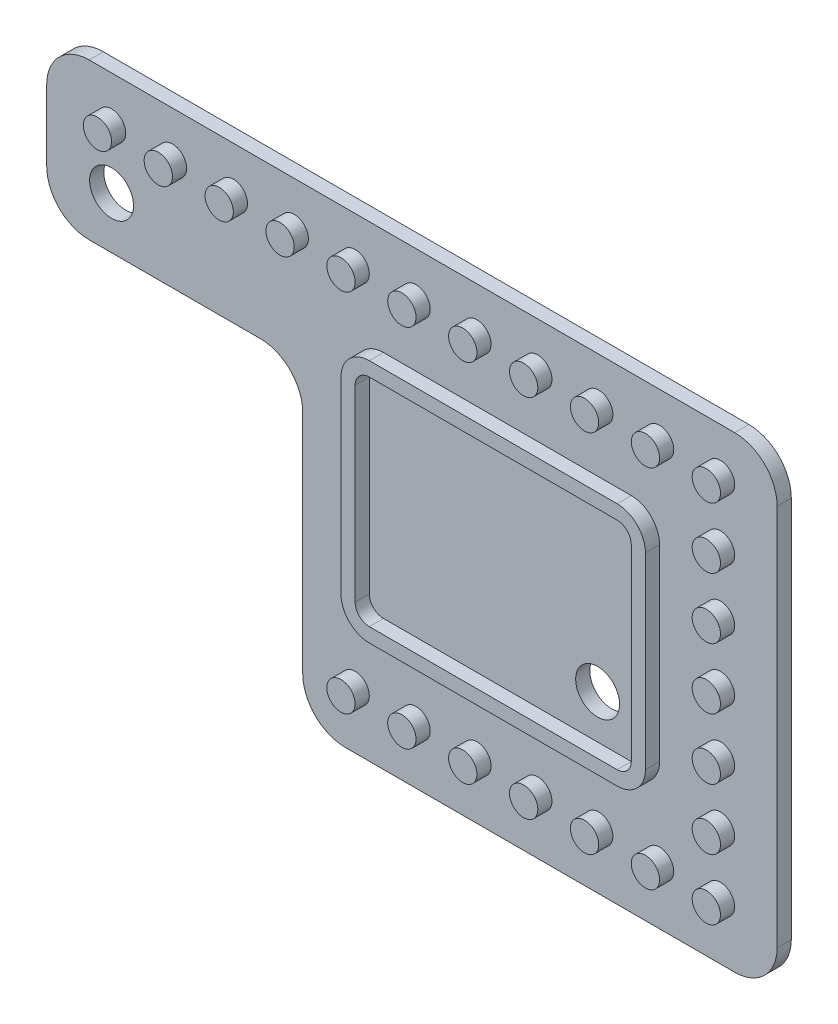
from build123d import *

# Parameters (mm, degrees)
BOSS_EXTRUDE1_DEPTH = 1
SKETCH2_R           = 1
BOSS_EXTRUDE2_DEPTH = 1
FILLET1_R           = 3
CUT_EXTRUDE1_REACH  = 72.674
SKETCH3_R           = 1.55


with BuildPart() as part:
    # Sketch1 → Boss-Extrude1 (new body)
    with BuildSketch(Plane.XY):
        Polygon((-8, 5), (-8, 38), (-59.580513121, 38), (-59.580513121, 27), (-41.5, 27), (-41.5, 5), align=None)
    extrude(amount=BOSS_EXTRUDE1_DEPTH)

    # Sketch2 → Boss-Extrude2 (add)
    # profile 1 of 24: a face of its own
    with BuildSketch(Plane.XY.offset(1)):
        with Locations((-12, 9)):
            Circle(SKETCH2_R)
    # profile 2 of 24: a face of its own
    with BuildSketch(Plane.XY.offset(1)):
        with Locations((-12, 13.3)):
            Circle(SKETCH2_R)
    # profile 3 of 24: a face of its own
    with BuildSketch(Plane.XY.offset(1)):
        with Locations((-12, 17.6)):
            Circle(SKETCH2_R)
    # profile 4 of 24: a face of its own
    with BuildSketch(Plane.XY.offset(1)):
        with Locations((-12, 21.9)):
            Circle(SKETCH2_R)
    # profile 5 of 24: a face of its own
    with BuildSketch(Plane.XY.offset(1)):
        with Locations((-12, 26.2)):
            Circle(SKETCH2_R)
    # profile 6 of 24: a face of its own
    with BuildSketch(Plane.XY.offset(1)):
        with Locations((-12, 30.5)):
            Circle(SKETCH2_R)
    # profile 7 of 24: a face of its own
    with BuildSketch(Plane.XY.offset(1)):
        with Locations((-12, 34.8)):
            Circle(SKETCH2_R)
    # profile 8 of 24: a face of its own
    with BuildSketch(Plane.XY.offset(1)):
        with Locations((-16.3, 9)):
            Circle(SKETCH2_R)
    # profile 9 of 24: a face of its own
    with BuildSketch(Plane.XY.offset(1)):
        with Locations((-20.6, 9)):
            Circle(SKETCH2_R)
    # profile 10 of 24: a face of its own
    with BuildSketch(Plane.XY.offset(1)):
        with Locations((-24.9, 9)):
            Circle(SKETCH2_R)
    # profile 11 of 24: a face of its own
    with BuildSketch(Plane.XY.offset(1)):
        with Locations((-29.2, 9)):
            Circle(SKETCH2_R)
    # profile 12 of 24: a face of its own
    with BuildSketch(Plane.XY.offset(1)):
        with Locations((-33.5, 9)):
            Circle(SKETCH2_R)
    # profile 13 of 24: a face of its own
    with BuildSketch(Plane.XY.offset(1)):
        with Locations((-37.8, 9)):
            Circle(SKETCH2_R)
    # profile 14 of 24: a face of its own
    with BuildSketch(Plane.XY.offset(1)):
        with Locations((-16.3, 34.8)):
            Circle(SKETCH2_R)
    # profile 15 of 24: a face of its own
    with BuildSketch(Plane.XY.offset(1)):
        with Locations((-20.6, 34.8)):
            Circle(SKETCH2_R)
    # profile 16 of 24: a face of its own
    with BuildSketch(Plane.XY.offset(1)):
        with Locations((-24.9, 34.8)):
            Circle(SKETCH2_R)
    # profile 17 of 24: a face of its own
    with BuildSketch(Plane.XY.offset(1)):
        with Locations((-29.2, 34.8)):
            Circle(SKETCH2_R)
    # profile 18 of 24: a face of its own
    with BuildSketch(Plane.XY.offset(1)):
        with Locations((-33.5, 34.8)):
            Circle(SKETCH2_R)
    # profile 19 of 24: a face of its own
    with BuildSketch(Plane.XY.offset(1)):
        with Locations((-37.8, 34.8)):
            Circle(SKETCH2_R)
    # profile 20 of 24: a face of its own
    with BuildSketch(Plane.XY.offset(1)):
        with Locations((-42.1, 34.8)):
            Circle(SKETCH2_R)
    # profile 21 of 24: a face of its own
    with BuildSketch(Plane.XY.offset(1)):
        with Locations((-46.4, 34.8)):
            Circle(SKETCH2_R)
    # profile 22 of 24: a face of its own
    with BuildSketch(Plane.XY.offset(1)):
        with Locations((-50.7, 34.8)):
            Circle(SKETCH2_R)
    # profile 23 of 24: a face of its own
    with BuildSketch(Plane.XY.offset(1)):
        with Locations((-55, 34.8)):
            Circle(SKETCH2_R)
    # profile 24 of 24: a face of its own
    with BuildSketch(Plane.XY.offset(1)):
        with BuildLine():
            Line((-35.8, 30.5), (-18.3, 30.5))
            ThreePointArc((-18.3, 30.5), (-16.885786438, 29.914213562), (-16.3, 28.5))
            Line((-16.3, 28.5), (-16.3, 15.236025644))
            ThreePointArc((-16.3, 15.236025644), (-16.885786438, 13.821812082), (-18.3, 13.236025644))
            Line((-18.3, 13.236025644), (-35.8, 13.236025644))
            ThreePointArc((-35.8, 13.236025644), (-37.214213562, 13.821812082), (-37.8, 15.236025644))
            Line((-37.8, 15.236025644), (-37.8, 28.5))
            ThreePointArc((-37.8, 28.5), (-37.214213562, 29.914213562), (-35.8, 30.5))
        make_face()
        with BuildLine():
            Line((-35.8, 29.5), (-18.3, 29.5))
            ThreePointArc((-18.3, 29.5), (-17.592893219, 29.207106781), (-17.3, 28.5))
            Line((-17.3, 28.5), (-17.3, 15.236025644))
            ThreePointArc((-17.3, 15.236025644), (-17.592893219, 14.528918863), (-18.3, 14.236025644))
            Line((-18.3, 14.236025644), (-35.8, 14.236025644))
            ThreePointArc((-35.8, 14.236025644), (-36.507106781, 14.528918863), (-36.8, 15.236025644))
            Line((-36.8, 15.236025644), (-36.8, 28.5))
            ThreePointArc((-36.8, 28.5), (-36.507106781, 29.207106781), (-35.8, 29.5))
        make_face(mode=Mode.SUBTRACT)
    extrude(amount=BOSS_EXTRUDE2_DEPTH)

    # Fillet1
    fillet1_edges = [part.edges().sort_by_distance(p)[0] for p in [
        (-8, 38, 0.5),
        (-8, 5, 0.5),
        (-41.5, 5, 0.5),
        (-41.5, 27, 0.5),
        (-59.580513121, 27, 0.5),
        (-59.580513121, 38, 0.5),
    ]]
    fillet(fillet1_edges, radius=FILLET1_R)

    # Sketch3 → Cut-Extrude1 (cut, up to next)
    with BuildSketch(Plane.XY.offset(1), mode=Mode.PRIVATE) as cut_extrude1_sk1:
        with Locations((-20.677552724, 17.314204089)):
            Circle(SKETCH3_R)
    cut_extrude1_tool1 = extrude(cut_extrude1_sk1.sketch, amount=-CUT_EXTRUDE1_REACH, mode=Mode.PRIVATE) & part.part
    # Sketch3 → Cut-Extrude1 (cut, up to next)
    with BuildSketch(Plane.XY.offset(1), mode=Mode.PRIVATE) as cut_extrude1_sk2:
        with Locations((-55, 30.651276125)):
            Circle(SKETCH3_R)
    cut_extrude1_tool2 = extrude(cut_extrude1_sk2.sketch, amount=-CUT_EXTRUDE1_REACH, mode=Mode.PRIVATE) & part.part
    add(cut_extrude1_tool1.solids().sort_by_distance((-20.677553, 17.314204, 1))[0], mode=Mode.SUBTRACT)
    add(cut_extrude1_tool2.solids().sort_by_distance((-55, 30.651276, 1))[0], mode=Mode.SUBTRACT)


solid = part.part
